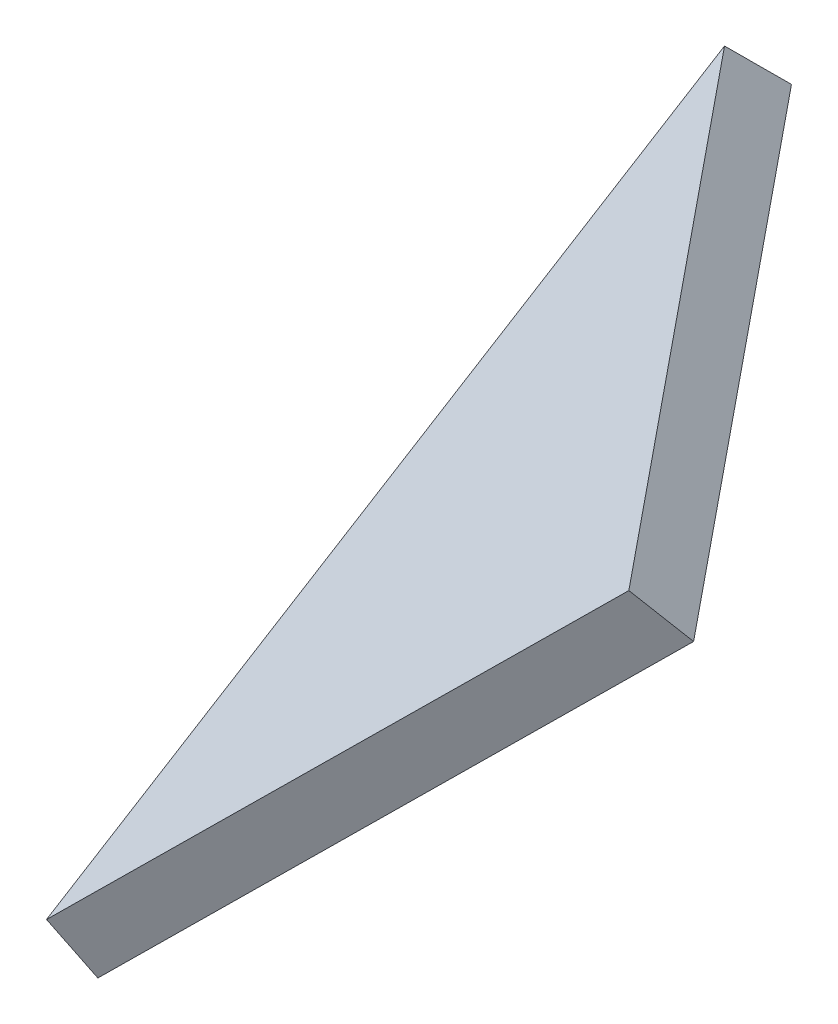
from build123d import *

# Parameters (mm, degrees)
BOSS_EXTRUDE1_DEPTH = 70
CHAMFER1_SIZE2      = 6.345862846
CHAMFER1_SIZE       = 70
CHAMFER2_SIZE2      = 6.345862846
CHAMFER2_SIZE       = 70
CHAMFER3_SIZE2      = 6.345862846
CHAMFER3_SIZE       = 70


with BuildPart() as part:
    # Sketch1 → Boss-Extrude1 (new body)
    with BuildSketch(Plane(origin=(-1433.119965314, 1495.839685025, 1008.740075281), x_dir=(0.7358390900822849, 0.2934391216969858, 0.6102739674642665), z_dir=(-0.6219840117130521, 0.6492048053824052, 0.43780019397178355))):
        Polygon((-160.176034679, 64.657883799), (-851.787483691, -622.240132354), (-1100.852890984, 320.161960115), align=None)
    extrude(amount=BOSS_EXTRUDE1_DEPTH)

    # Chamfer1
    chamfer1_edges = [part.edges().sort_by_distance(p)[0] for p in [
        (-1923.619381658, 1197.172763007, 914.663383892),
    ]]
    chamfer1_side = [part.faces().sort_by_distance(p)[0] for p in [
        (-1923.540441153, 1197.090367714, 914.607819493),
    ]]
    chamfer(chamfer1_edges, length=CHAMFER1_SIZE - 0.0001, length2=CHAMFER1_SIZE2 - 0.0001, reference=chamfer1_side[0])  # a hair under: the kernel refuses the full size

    # Chamfer2
    chamfer2_edges = [part.edges().sort_by_distance(p)[0] for p in [
        (-1891.447617283, 1490.922853817, 524.774000982),
    ]]
    chamfer2_side = [part.faces().sort_by_distance(p)[0] for p in [
        (-1891.368676779, 1490.840458524, 524.718436582),
    ]]
    chamfer(chamfer2_edges, length=CHAMFER2_SIZE - 0.0001, length2=CHAMFER2_SIZE2 - 0.0001, reference=chamfer2_side[0])  # a hair under: the kernel refuses the full size

    # Chamfer3
    chamfer3_edges = [part.edges().sort_by_distance(p)[0] for p in [
        (-2235.510357018, 1148.804652005, 543.283032262),
    ]]
    chamfer3_side = [part.faces().sort_by_distance(p)[0] for p in [
        (-2235.431416513, 1148.722256712, 543.227467862),
    ]]
    chamfer(chamfer3_edges, length=CHAMFER3_SIZE - 0.0001, length2=CHAMFER3_SIZE2 - 0.0001, reference=chamfer3_side[0])  # a hair under: the kernel refuses the full size


solid = part.part
